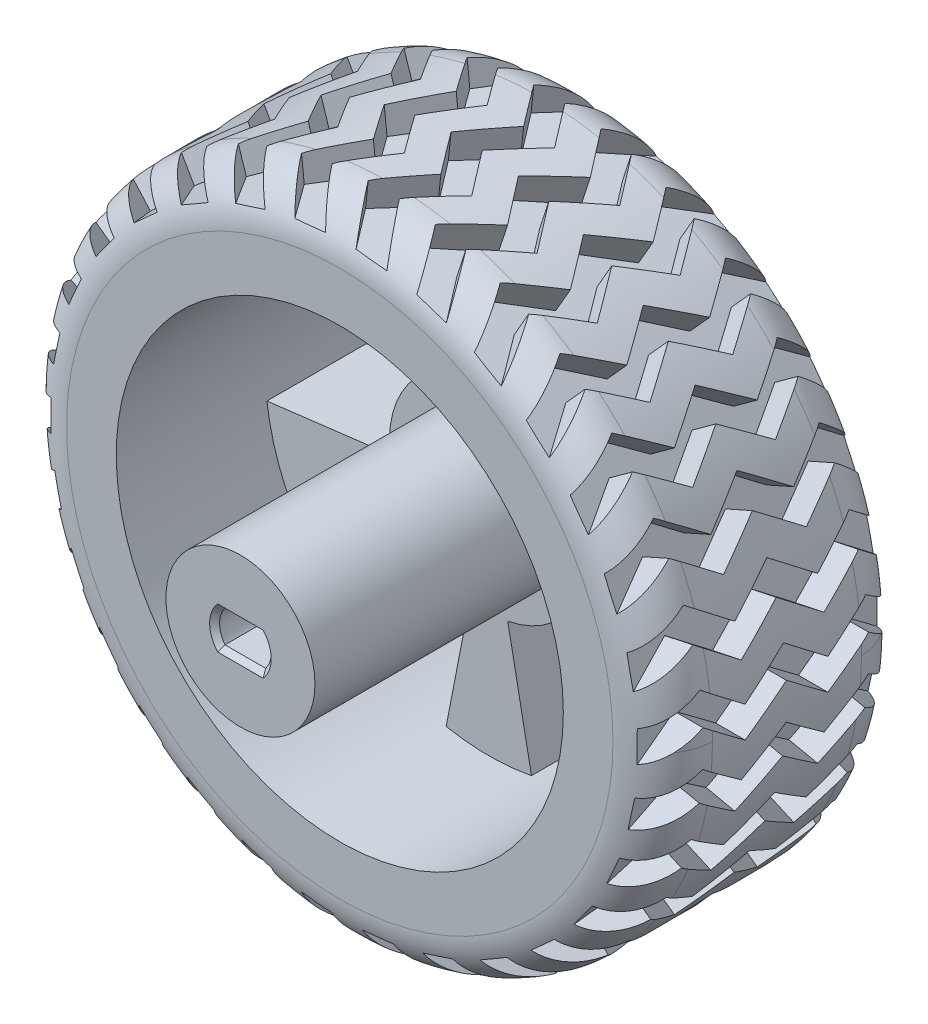
from build123d import *
from build123d.topology import SkipClean

# Parameters (mm, degrees)
ESQUISSE1_R                  = 32.5
BOSS_EXTRU_1_DEPTH           = 25
COQUE1_T                     = -10
ESQUISSE2_R                  = 7.5
BOSS_EXTRU_2_DEPTH           = 25
CONG_1_R                     = 5
ENL_V_MAT_EXTRU_1_DEPTH      = 53.321123903
ENL_V_MAT_EXTRU_2_DEPTH      = 3
R_P_TITION_CIRCULAIRE1_COUNT = 30
ENL_V_MAT_EXTRU_3_DEPTH      = 7
CHANFREIN1_SIZE              = 0.5


with BuildPart() as part:
    # Esquisse1 → Boss.-Extru.1 (new body)
    with BuildSketch(Plane.XY):
        Circle(ESQUISSE1_R)
    extrude(amount=BOSS_EXTRU_1_DEPTH)

    # Coque1
    coque1_openings = [part.faces().sort_by_distance(p)[0] for p in [
        (0, 0, 25),
    ]]
    offset(amount=COQUE1_T, openings=coque1_openings, kind=Kind.INTERSECTION)

    # Esquisse2 → Boss.-Extru.2 (add)
    with BuildSketch(Plane.XY.offset(10)):
        Circle(ESQUISSE2_R)
    extrude(amount=BOSS_EXTRU_2_DEPTH)

    # Congé1
    cong_1_edges = [part.edges().sort_by_distance(p)[0] for p in [
        (-32.5, 0, 0),
        (-32.5, 0, 25),
    ]]
    fillet(cong_1_edges, radius=CONG_1_R)

    # Esquisse4 → Enlèv. mat.-Extru.1 (cut, through all)
    with SkipClean():  # the faces are left unmerged after this step: merging them gives an invalid solid
        with BuildSketch(Plane.XY.offset(10)):
            with BuildLine():
                Line((-9.508910889, 20.391925208), (-4.226182617, 9.06307787))
                ThreePointArc((-4.226182617, 9.06307787), (0, 10), (4.226182617, 9.06307787))
                Line((4.226182617, 9.06307787), (9.508910889, 20.391925208))
                ThreePointArc((9.508910889, 20.391925208), (0, 22.5), (-9.508910889, 20.391925208))
            make_face()
            with BuildLine():
                Line((22.332288412, -2.742060227), (9.925461516, -1.218693434))
                ThreePointArc((9.925461516, -1.218693434), (9.510565163, 3.090169944), (7.313537016, 6.819983601))
                Line((7.313537016, 6.819983601), (16.455458286, 15.344963101))
                ThreePointArc((16.455458286, 15.344963101), (21.398771617, 6.952882373), (22.332288412, -2.742060227))
            make_face()
            with BuildLine():
                Line((4.293202396, -22.086611628), (1.908089954, -9.816271834))
                ThreePointArc((1.908089954, -9.816271834), (5.877852523, -8.090169944), (8.746197071, -4.848096202))
                Line((8.746197071, -4.848096202), (19.678943411, -10.908216456))
                ThreePointArc((19.678943411, -10.908216456), (13.225168177, -18.202882373), (4.293202396, -22.086611628))
            make_face()
            with BuildLine():
                Line((-19.678943411, -10.908216456), (-8.746197071, -4.848096202))
                ThreePointArc((-8.746197071, -4.848096202), (-5.877852523, -8.090169944), (-1.908089954, -9.816271834))
                Line((-1.908089954, -9.816271834), (-4.293202396, -22.086611628))
                ThreePointArc((-4.293202396, -22.086611628), (-13.225168177, -18.202882373), (-19.678943411, -10.908216456))
            make_face()
            with BuildLine():
                Line((-16.455458286, 15.344963101), (-7.313537016, 6.819983601))
                ThreePointArc((-7.313537016, 6.819983601), (-9.510565163, 3.090169944), (-9.925461516, -1.218693434))
                Line((-9.925461516, -1.218693434), (-22.332288412, -2.742060227))
                ThreePointArc((-22.332288412, -2.742060227), (-21.398771617, 6.952882373), (-16.455458286, 15.344963101))
            make_face()
        extrude(amount=-ENL_V_MAT_EXTRU_1_DEPTH, mode=Mode.SUBTRACT)

    # Esquisse5 → Enlèv. mat.-Extru.2 (cut)
    with SkipClean():  # the faces are left unmerged after this step: merging them gives an invalid solid
        with BuildSketch(Plane(origin=(32.5, 0, 0), x_dir=(0, 0, -1), z_dir=(1, 0, 0))):
            Polygon((0, 1.5625), (-4.166666667, 4.6875), (-8.333333333, 1.5625), (-12.5, 4.6875), (-16.666666667, 1.5625), (-20.833333333, 4.6875), (-25, 1.5625), (-25, -1.5625), (-20.833333333, 1.5625), (-16.666666667, -1.5625), (-12.5, 1.5625), (-8.333333333, -1.5625), (-4.166666667, 1.5625), (0, -1.5625), align=None)
        enl_v_mat_extru_2 = extrude(amount=-ENL_V_MAT_EXTRU_2_DEPTH, mode=Mode.SUBTRACT)

    # Répétition circulaire1: Enlèv. mat.-Extru.2 ×30 about axis
    with SkipClean():  # the faces are left unmerged after this step: merging them gives an invalid solid
        r_p_tition_circulaire1_axis = Axis((0, 0, 0), (0, 0, -1))
        for i in range(1, R_P_TITION_CIRCULAIRE1_COUNT):
            add(enl_v_mat_extru_2.rotate(r_p_tition_circulaire1_axis, i * 360 / R_P_TITION_CIRCULAIRE1_COUNT), mode=Mode.SUBTRACT)

    # Esquisse6 → Enlèv. mat.-Extru.3 (cut)
    with SkipClean():  # the faces are left unmerged after this step: merging them gives an invalid solid
        with BuildSketch(Plane.XY.offset(35)):
            with BuildLine():
                Line((-2.049390153, 1.6), (2.049390153, 1.6))
                ThreePointArc((2.049390153, 1.6), (2.6, 0), (2.049390153, -1.6))
                Line((2.049390153, -1.6), (-2.049390153, -1.6))
                ThreePointArc((-2.049390153, -1.6), (-2.6, 0), (-2.049390153, 1.6))
            make_face()
        extrude(amount=-ENL_V_MAT_EXTRU_3_DEPTH, mode=Mode.SUBTRACT)

    # Chanfrein1
    chanfrein1_edges = [part.edges().sort_by_distance(p)[0] for p in [
        (0, -1.6, 35),
        (2.6, 0, 35),
        (-2.6, 0, 35),
        (0, 1.6, 35),
    ]]
    chamfer(chanfrein1_edges, length=CHANFREIN1_SIZE)


solid = part.part
